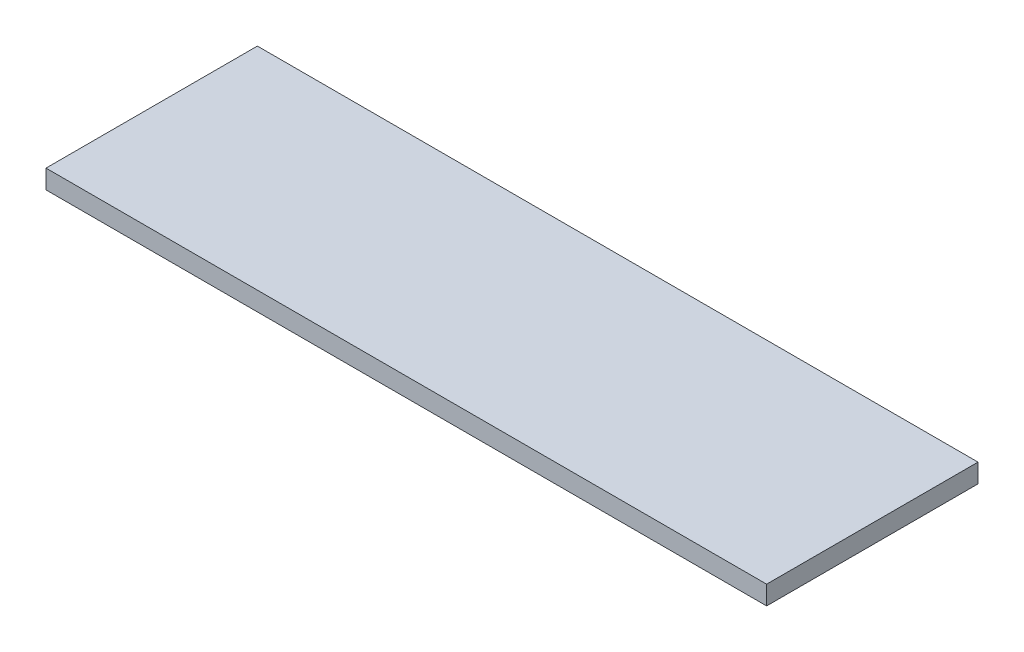
from build123d import *

# Parameters (mm, degrees)
SKETCH1_W           = 242.4
SKETCH1_H           = 71.1
BOSS_EXTRUDE1_DEPTH = 6.35


with BuildPart() as part:
    # Sketch1 → Boss-Extrude1 (new body)
    with BuildSketch(Plane(origin=(0, 0, 0), x_dir=(1, 0, 0), z_dir=(0, 1, 0))):
        with Locations((121.2, 35.55)):
            Rectangle(SKETCH1_W, SKETCH1_H)
    extrude(amount=BOSS_EXTRUDE1_DEPTH)


solid = part.part
